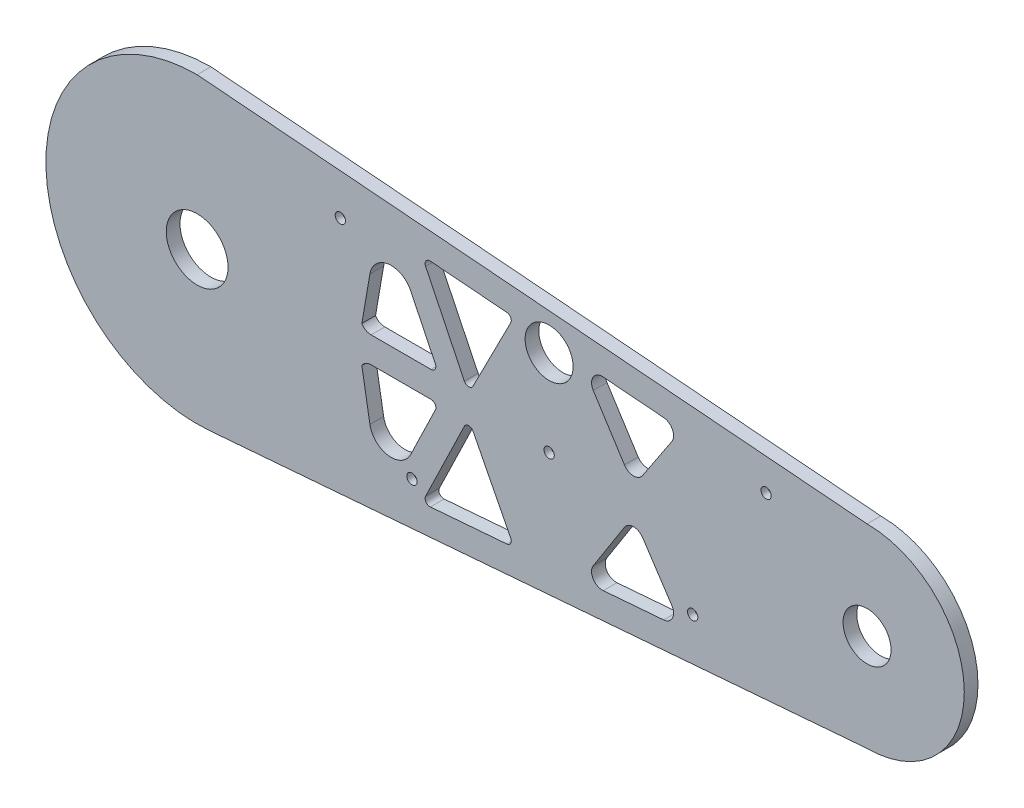
from build123d import *

# Parameters (mm, degrees)
SKETCH1_R             = 14.29385
SKETCH1_R_2           = 11.11
SKETCH1_R_3           = 11.1125
BOSS_EXTRUDE1_DEPTH   = 6.35
CROQUIS1_R            = 2.38125
CORTAR_EXTRUIR1_DEPTH = 50
CROQUIS4_R            = 5
CORTAR_EXTRUIR2_DEPTH = 3.175
CROQUIS5_R            = 5
CORTAR_EXTRUIR3_DEPTH = 3.175
CROQUIS6_R            = 2.38125
CORTAR_EXTRUIR4_DEPTH = 10
CROQUIS7_R            = 2.38125
CORTAR_EXTRUIR5_DEPTH = 10
CROQUIS8_R            = 5
CORTAR_EXTRUIR6_DEPTH = 3.16


with BuildPart() as part:
    # Sketch1 → Boss-Extrude1 (new body)
    with BuildSketch(Plane.XY):
        with BuildLine():
            Line((0, 70), (310, 45))
            ThreePointArc((310, 45), (355, 0), (310, -45))
            Line((310, -45), (5.171398252, -69.808714643))
            ThreePointArc((5.171398252, -69.808714643), (-69.952162315, -2.587467389), (0, 70))
        make_face()
        Circle(SKETCH1_R, mode=Mode.SUBTRACT)
        with Locations((310, 0)):
            Circle(SKETCH1_R_2, mode=Mode.SUBTRACT)
        with Locations((162.878542763, 40)):
            Circle(SKETCH1_R_3, mode=Mode.SUBTRACT)
        with BuildLine():
            Line((107.898974887, 49.259511156), (143.314248041, 46.40344074))
            ThreePointArc((143.314248041, 46.40344074), (145.081219842, 45.26787105), (145.119309278, 43.167809846))
            Line((145.119309278, 43.167809846), (127.644599078, 8.986405389))
            ThreePointArc((127.644599078, 8.986405389), (125.636435104, 7.772468257), (123.654849619, 9.02932341))
            Line((123.654849619, 9.02932341), (105.714286665, 46.066798282))
            ThreePointArc((105.714286665, 46.066798282), (105.88073682, 48.296719246), (107.898974887, 49.259511156))
        make_face(mode=Mode.SUBTRACT)
        with BuildLine():
            Line((80.485072492, 6), (108.232970891, 6))
            ThreePointArc((108.232970891, 6), (110.121208762, 7.04499918), (110.23852663, 9.199924251))
            Line((110.23852663, 9.199924251), (98.797478536, 32.819446805))
            ThreePointArc((98.797478536, 32.819446805), (88.396572806, 38.361410035), (79.941746192, 30.151166228))
            Line((79.941746192, 30.151166228), (76.210646932, 8.405913238))
            ThreePointArc((76.210646932, 8.405913238), (78.032567019, 6.642797124), (80.485072492, 6))
        make_face(mode=Mode.SUBTRACT)
        with BuildLine():
            Line((219.623774494, 32.810522613), (206.130928429, 12.417497436))
            ThreePointArc((206.130928429, 12.417497436), (201.919524559, 10.176643248), (197.745901529, 12.48710226))
            Line((197.745901529, 12.48710226), (183.296864227, 35.133505128))
            ThreePointArc((183.296864227, 35.133505128), (183.227765467, 40.400743015), (187.913912204, 42.80669363))
            Line((187.913912204, 42.80669363), (215.855795571, 40.553315939))
            ThreePointArc((215.855795571, 40.553315939), (219.949772588, 37.757395035), (219.623774494, 32.810522613))
        make_face(mode=Mode.SUBTRACT)
        with BuildLine():
            Line((98.797478536, -32.819446805), (110.23852663, -9.199924251))
            ThreePointArc((110.23852663, -9.199924251), (110.121208762, -7.04499918), (108.232970891, -6))
            Line((108.232970891, -6), (80.485072492, -6))
            ThreePointArc((80.485072492, -6), (78.032567019, -6.642797124), (76.210646932, -8.405913238))
            Line((76.210646932, -8.405913238), (79.941746192, -30.151166228))
            ThreePointArc((79.941746192, -30.151166228), (88.396572806, -38.361410035), (98.797478536, -32.819446805))
        make_face(mode=Mode.SUBTRACT)
        with BuildLine():
            Line((187.913912204, -42.80669363), (215.855795571, -40.553315939))
            ThreePointArc((215.855795571, -40.553315939), (219.949772588, -37.757395035), (219.623774494, -32.810522613))
            Line((219.623774494, -32.810522613), (206.130928429, -12.417497436))
            ThreePointArc((206.130928429, -12.417497436), (201.919524559, -10.176643248), (197.745901529, -12.48710226))
            Line((197.745901529, -12.48710226), (183.296864227, -35.133505128))
            ThreePointArc((183.296864227, -35.133505128), (183.227765467, -40.400743015), (187.913912204, -42.80669363))
        make_face(mode=Mode.SUBTRACT)
        with BuildLine():
            Line((123.654849619, -9.02932341), (105.714286665, -46.066798282))
            ThreePointArc((105.714286665, -46.066798282), (105.88073682, -48.296719246), (107.898974887, -49.259511156))
            Line((107.898974887, -49.259511156), (143.314248041, -46.40344074))
            ThreePointArc((143.314248041, -46.40344074), (145.081219842, -45.26787105), (145.119309278, -43.167809846))
            Line((145.119309278, -43.167809846), (127.644599078, -8.986405389))
            ThreePointArc((127.644599078, -8.986405389), (125.636435104, -7.772468257), (123.654849619, -9.02932341))
        make_face(mode=Mode.SUBTRACT)
    extrude(amount=BOSS_EXTRUDE1_DEPTH)

    # Croquis1 → Cortar-Extruir1 (cut)
    with BuildSketch(Plane.XY.offset(6.35)):
        with Locations((99.417366651, -42.272966779)):
            Circle(CROQUIS1_R)
        with Locations((229.299162877, -31.702435007)):
            Circle(CROQUIS1_R)
    extrude(amount=-CORTAR_EXTRUIR1_DEPTH, mode=Mode.SUBTRACT)

    # Croquis4 → Cortar-Extruir2 (cut)
    with BuildSketch(Plane(origin=(0, 0, 0), x_dir=(-1, 0, 0), z_dir=(0, 0, -1))):
        with Locations((-229.299162877, -31.702435007)):
            Circle(CROQUIS4_R)
        with Locations((-99.417366651, -42.272966779)):
            Circle(CROQUIS4_R)
    extrude(amount=-CORTAR_EXTRUIR2_DEPTH, mode=Mode.SUBTRACT)

    # Croquis5 → Cortar-Extruir3 (cut)
    with BuildSketch(Plane(origin=(0, 0, 0), x_dir=(-1, 0, 0), z_dir=(0, 0, -1))):
        with Locations((-162.878542763, 0)):
            Circle(CROQUIS5_R)
    extrude(amount=-CORTAR_EXTRUIR3_DEPTH, mode=Mode.SUBTRACT)

    # Croquis6 → Cortar-Extruir4 (cut)
    with BuildSketch(Plane(origin=(0, 0, 0), x_dir=(-1, 0, 0), z_dir=(0, 0, -1))):
        with Locations((-162.878542763, 0)):
            Circle(CROQUIS6_R)
    extrude(amount=-CORTAR_EXTRUIR4_DEPTH, mode=Mode.SUBTRACT)

    # Croquis7 → Cortar-Extruir5 (cut)
    with BuildSketch(Plane(origin=(0, 0, 0), x_dir=(-1, 0, 0), z_dir=(0, 0, -1))):
        with Locations((-66.263169386, 45.68611009)):
            Circle(CROQUIS7_R)
        with Locations((-263.293381054, 34.027262471)):
            Circle(CROQUIS7_R)
    extrude(amount=-CORTAR_EXTRUIR5_DEPTH, mode=Mode.SUBTRACT)

    # Croquis8 → Cortar-Extruir6 (cut)
    with BuildSketch(Plane(origin=(0, 0, 0), x_dir=(-1, 0, 0), z_dir=(0, 0, -1))):
        with Locations((-263.293381054, 34.027262471)):
            Circle(CROQUIS8_R)
        with Locations((-66.263169386, 45.68611009)):
            Circle(CROQUIS8_R)
    extrude(amount=-CORTAR_EXTRUIR6_DEPTH, mode=Mode.SUBTRACT)


solid = part.part
